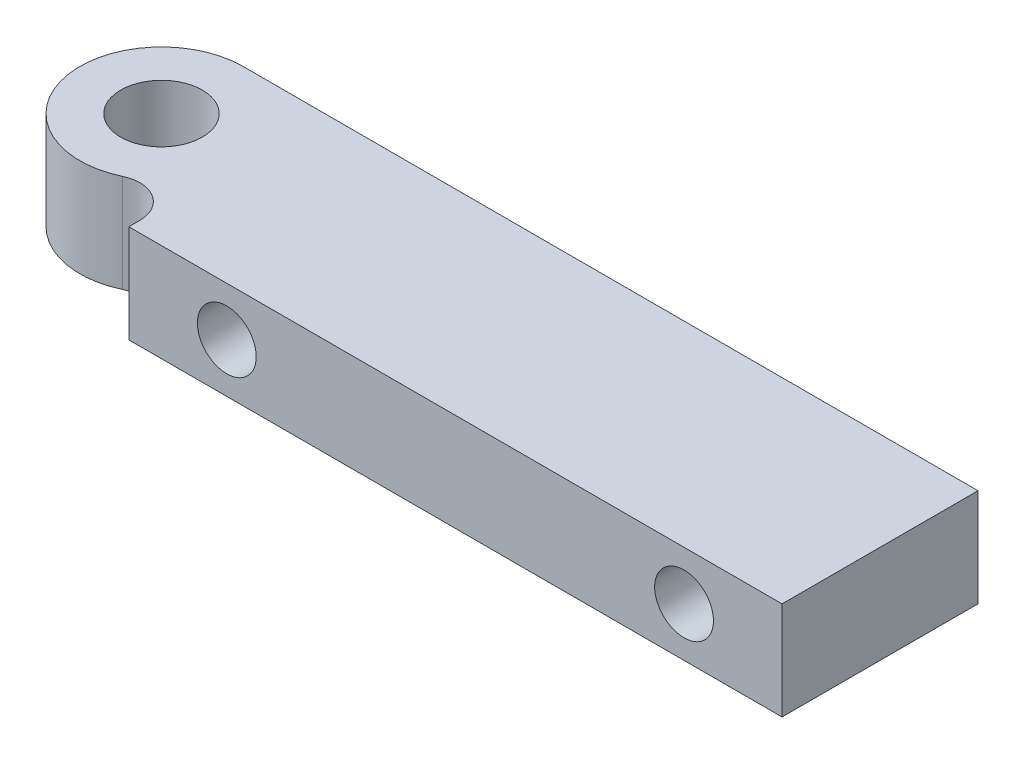
from build123d import *

# Parameters (mm, degrees)
SKETCH1_R           = 3.175
BOSS_EXTRUDE1_DEPTH = 3.8099999999999996
FILLET1_R           = 2.54
SKETCH2_R           = 2.2859999999999947
SKETCH2_R_2         = 2.2860000000000014
CUT_EXTRUDE1_DEPTH  = 5.08


with BuildPart() as part:
    # Sketch1 → Boss-Extrude1 (new, symmetric)
    with BuildSketch(Plane(origin=(0, 0, 0), x_dir=(1, 0, 0), z_dir=(0, 1, 0))):
        with BuildLine():
            Line((0, 6.35), (12.366459894249573, 6.35))
            Line((12.366459894249573, 6.35), (57.15, 6.35))
            Line((57.15, 6.35), (57.15, -8.889999999999999))
            Line((57.15, -8.889999999999999), (6.350000000000001, -8.889999999999999))
            Line((6.350000000000001, -8.889999999999999), (6.3500000000000005, 8.7e-16))
            ThreePointArc((6.3500000000000005, 8.7e-16), (-4.490128060534578, -4.490128060534576), (0, 6.35))
        make_face()
        Circle(SKETCH1_R, mode=Mode.SUBTRACT)
    extrude(amount=BOSS_EXTRUDE1_DEPTH, both=True)

    # Fillet1
    fillet1_edges = [part.edges().sort_by_distance(p)[0] for p in [
        (6.350000000000001, 0, -8.7e-16),
    ]]
    fillet(fillet1_edges, radius=FILLET1_R)

    # Sketch2 → Cut-Extrude1 (cut)
    with BuildSketch(Plane.XY.offset(8.889999999999999)):
        with Locations((49.53000000000013, 1.171e-14)):
            Circle(SKETCH2_R)
        with Locations((13.970000000000093, 1.171e-14)):
            Circle(SKETCH2_R_2)
    extrude(amount=-CUT_EXTRUDE1_DEPTH, mode=Mode.SUBTRACT)


solid = part.part
